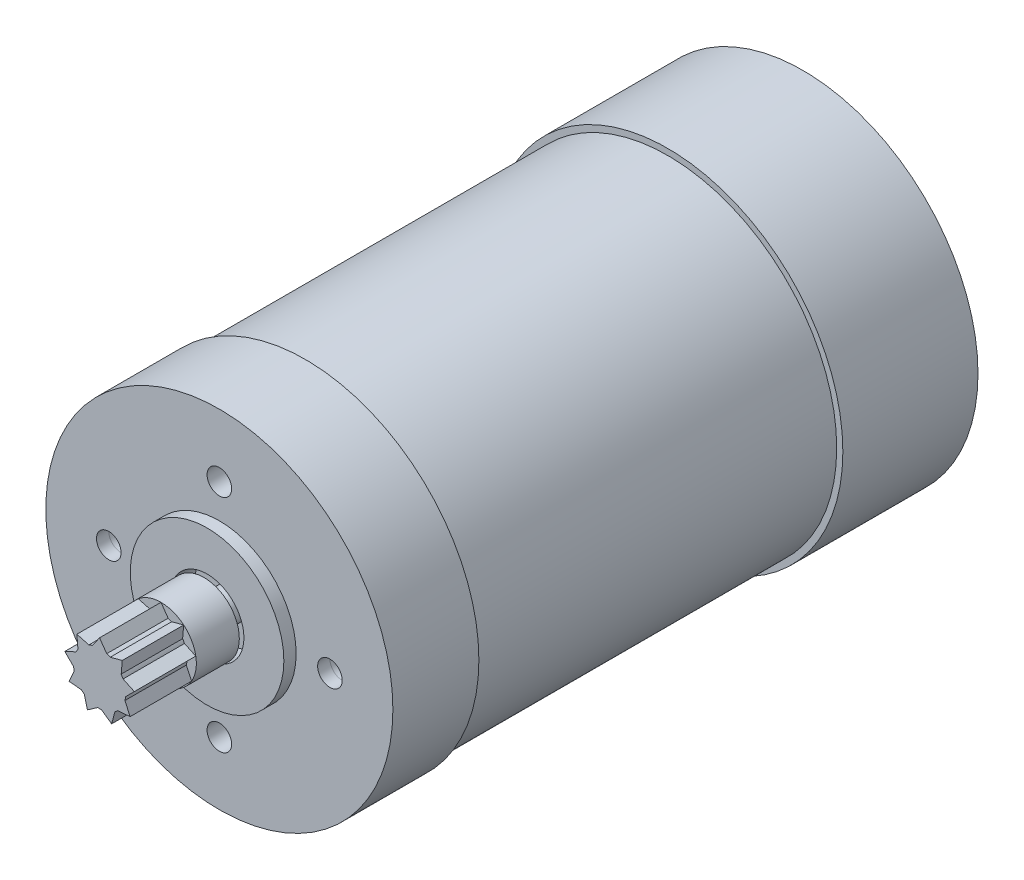
from build123d import *

# Parameters (mm, degrees)
SKETCH5_R           = 2
CUT_EXTRUDE1_DEPTH  = 3
SKETCH13_R          = 6
CUT_EXTRUDE3_DEPTH  = 4
SKETCH14_R          = 2.5
BOSS_EXTRUDE2_DEPTH = 4.5
SKETCH15_R          = 5.75
BOSS_EXTRUDE3_DEPTH = 17
CUT_EXTRUDE7_START  = -10
CUT_EXTRUDE7_DEPTH  = 10
CUT_EXTRUDE9_DEPTH  = 8
BOSS_EXTRUDE7_DEPTH = 6.25
CUT_EXTRUDE10_DEPTH = 5
SPLIT1_START        = -97
SPLIT1_OUTLINE_R    = 28.5
SPLIT1_DEPTH        = 22
SPLIT1_START_2      = -92
SPLIT1_2_DEPTH      = 17
SPLIT1_START_3      = -75
SPLIT1_3_OUTLINE_R  = 27.5
SPLIT1_3_DEPTH      = 59
SPLIT1_START_4      = -105
SPLIT1_4_OUTLINE_R  = 28.5
SPLIT1_4_DEPTH      = 89
SPLIT1_START_5      = -4
SPLIT1_5_OUTLINE_R  = 5.75
SPLIT1_5_DEPTH      = 21.5
SPLIT1_START_6      = 0.5
SPLIT1_6_DEPTH      = 17
SPLIT1_7_DEPTH      = 7
SPLIT1_8_OUTLINE_R  = 2.5
SPLIT1_8_DEPTH      = 4.5
SPLIT1_START_7      = -103.5
SPLIT1_9_DEPTH      = 6.25
SPLIT1_10_DEPTH     = 8


# Read off the part's stored shape, not the designer's step: Split1
with BuildPart() as part:
    # Sketch3 → Revolve1 (revolve)
    with BuildSketch(Plane(origin=(0, 0, 0), x_dir=(0, 0, -1), z_dir=(1, 0, 0)), mode=Mode.PRIVATE) as revolve1_sk:
        Polygon((0, 0), (0, 12.5), (2, 12.5), (2, 28.25), (16, 28.25), (16, 27.5), (75, 27.5), (75, 28.5), (97, 28.5), (97, 3), (105, 3), (105, 0), (97, 0), align=None)
    revolve(revolve1_sk.sketch.rotate(Axis((0, 0, 94.008643936), (0, 0, -1)), 90), axis=Axis((0, 0, 94.008643936), (0, 0, -1)))

    # Sketch5 → Cut-Extrude1 (cut)
    with BuildSketch(Plane.XY.offset(-2)):
        with Locations((0, 18)):
            Circle(SKETCH5_R)
        with Locations((18, 0)):
            Circle(SKETCH5_R)
        with Locations((0, -18)):
            Circle(SKETCH5_R)
        with Locations((-18, 0)):
            Circle(SKETCH5_R)
    extrude(amount=-CUT_EXTRUDE1_DEPTH, mode=Mode.SUBTRACT)

    # Sketch13 → Cut-Extrude3 (cut)
    with BuildSketch(Plane.XY):
        Circle(SKETCH13_R)
    extrude(amount=-CUT_EXTRUDE3_DEPTH, mode=Mode.SUBTRACT)

    # Sketch14 → Boss-Extrude2 (add)
    with BuildSketch(Plane.XY.offset(-4)):
        Circle(SKETCH14_R)
    extrude(amount=BOSS_EXTRUDE2_DEPTH)

    # Sketch15 → Boss-Extrude3 (add)
    with BuildSketch(Plane.XY.offset(0.5)):
        Circle(SKETCH15_R)
    extrude(amount=BOSS_EXTRUDE3_DEPTH)

    # Sketch17 → Cut-Extrude7 (cut)
    with BuildSketch(Plane.XY.offset(17.5).offset(CUT_EXTRUDE7_START)):
        with BuildLine():
            Line((-1.164124293, 4.087458211), (0, 5.75))
            ThreePointArc((0, 5.75), (-1.966615824, 5.40323257), (-3.696028756, 4.404755548))
            Line((-3.696028756, 4.404755548), (-1.735596548, 3.879459321))
            ThreePointArc((-1.735596548, 3.879459321), (-1.453585609, 3.993693638), (-1.164124293, 4.087458211))
        make_face()
        with BuildLine():
            Line((-3.519138439, 2.382889978), (-3.696028756, 4.404755548))
            ThreePointArc((-3.696028756, 4.404755548), (-4.979646072, 2.875), (-5.66264458, 0.998477022))
            Line((-5.66264458, 0.998477022), (-3.823212475, 1.856218299))
            ThreePointArc((-3.823212475, 1.856218299), (-3.680607966, 2.125), (-3.519138439, 2.382889978))
        make_face()
        with BuildLine():
            Line((-4.227508599, -0.436658959), (-5.66264458, 0.998477022))
            ThreePointArc((-5.66264458, 0.998477022), (-5.66264458, -0.998477022), (-4.979646072, -2.875))
            Line((-4.979646072, -2.875), (-4.121904795, -1.035567895))
            ThreePointArc((-4.121904795, -1.035567895), (-4.18543295, -0.738004755), (-4.227508599, -0.436658959))
        make_face()
        with BuildLine():
            Line((-2.957780502, -3.051890317), (-4.979646072, -2.875))
            ThreePointArc((-4.979646072, -2.875), (-3.696028756, -4.404755548), (-1.966615824, -5.40323257))
            Line((-1.966615824, -5.40323257), (-2.491912051, -3.442800362))
            ThreePointArc((-2.491912051, -3.442800362), (-2.731847341, -3.255688883), (-2.957780502, -3.051890317))
        make_face()
        with BuildLine():
            Line((-0.304074036, -4.239108277), (-1.966615824, -5.40323257))
            ThreePointArc((-1.966615824, -5.40323257), (0, -5.75), (1.966615824, -5.40323257))
            Line((1.966615824, -5.40323257), (0.304074036, -4.239108277))
            ThreePointArc((0.304074036, -4.239108277), (0, -4.25), (-0.304074036, -4.239108277))
        make_face()
        with BuildLine():
            ThreePointArc((1.966615824, -5.40323257), (3.696028756, -4.404755548), (4.979646072, -2.875))
            Line((4.979646072, -2.875), (2.957780502, -3.051890317))
            ThreePointArc((2.957780502, -3.051890317), (2.731847341, -3.255688883), (2.491912051, -3.442800362))
            Line((2.491912051, -3.442800362), (1.966615824, -5.40323257))
        make_face()
        with BuildLine():
            ThreePointArc((5.75, 0), (5.728119514, 0.501145521), (5.66264458, 0.998477022))
            Line((5.66264458, 0.998477022), (4.227508599, -0.436658959))
            ThreePointArc((4.227508599, -0.436658959), (4.18543295, -0.738004755), (4.121904795, -1.035567895))
            Line((4.121904795, -1.035567895), (4.979646072, -2.875))
            ThreePointArc((4.979646072, -2.875), (5.554073501, -1.488209509), (5.75, 0))
        make_face()
        with BuildLine():
            ThreePointArc((5.66264458, 0.998477022), (4.979646072, 2.875), (3.696028756, 4.404755548))
            Line((3.696028756, 4.404755548), (3.519138439, 2.382889978))
            ThreePointArc((3.519138439, 2.382889978), (3.680607966, 2.125), (3.823212475, 1.856218299))
            Line((3.823212475, 1.856218299), (5.66264458, 0.998477022))
        make_face()
        with BuildLine():
            ThreePointArc((3.696028756, 4.404755548), (1.966615824, 5.40323257), (0, 5.75))
            Line((0, 5.75), (1.164124293, 4.087458211))
            ThreePointArc((1.164124293, 4.087458211), (1.453585609, 3.993693638), (1.735596548, 3.879459321))
            Line((1.735596548, 3.879459321), (3.696028756, 4.404755548))
        make_face()
    extrude(amount=CUT_EXTRUDE7_DEPTH, mode=Mode.SUBTRACT)

    # Sketch24 → Cut-Extrude9 (cut)
    with BuildSketch(Plane(origin=(0, 0, -105), x_dir=(-1, 0, 0), z_dir=(0, 0, -1))):
        with BuildLine():
            Line((-2.8, -1.077032961), (2.8, -1.077032961))
            ThreePointArc((2.8, -1.077032961), (0, -3), (-2.8, -1.077032961))
        make_face()
    extrude(amount=-CUT_EXTRUDE9_DEPTH, mode=Mode.SUBTRACT)

    # Sketch26 → Boss-Extrude7 (add)
    with BuildSketch(Plane(origin=(0, 0, -103.5), x_dir=(-1, 0, 0), z_dir=(0, 0, -1))):
        Polygon((0, 11.547005384), (-10, 5.773502692), (-10, -5.773502692), (0, -11.547005384), (10, -5.773502692), (10, 5.773502692), align=None)
    extrude(amount=-BOSS_EXTRUDE7_DEPTH)

    # Sketch27 → Cut-Extrude10 (cut)
    with BuildSketch(Plane(origin=(0, 0, -97), x_dir=(-1, 0, 0), z_dir=(0, 0, -1))):
        with BuildLine():
            ThreePointArc((23.995222971, -0.478826225), (22.908918278, 7.154122122), (19.458462601, 14.048780488))
            ThreePointArc((19.458462601, 14.048780488), (14.571989651, 14.837692463), (13.783077676, 9.951219512))
            ThreePointArc((13.783077676, 9.951219512), (16.227150447, 5.06750317), (16.996616271, -0.339168576))
            ThreePointArc((16.996616271, -0.339168576), (20.426090797, -3.908300751), (23.995222971, -0.478826225))
        make_face()
        with BuildLine():
            ThreePointArc((-23.995222971, -0.478826225), (-22.908918278, 7.154122122), (-19.458462601, 14.048780488))
            ThreePointArc((-19.458462601, 14.048780488), (-14.571989651, 14.837692463), (-13.783077676, 9.951219512))
            ThreePointArc((-13.783077676, 9.951219512), (-16.227150447, 5.06750317), (-16.996616271, -0.339168576))
            ThreePointArc((-16.996616271, -0.339168576), (-20.426090797, -3.908300751), (-23.995222971, -0.478826225))
        make_face()
    extrude(amount=-CUT_EXTRUDE10_DEPTH, mode=Mode.SUBTRACT)

    # Split1 4 outline → Split1 4 (cut)
    with BuildSketch(Plane.XY.offset(SPLIT1_START_4)):
        Circle(SPLIT1_4_OUTLINE_R)
    extrude(amount=SPLIT1_4_DEPTH, mode=Mode.SUBTRACT)

    # Split1 5 outline → Split1 5 (cut)
    with BuildSketch(Plane.XY.offset(SPLIT1_START_5)):
        Circle(SPLIT1_5_OUTLINE_R)
    extrude(amount=SPLIT1_5_DEPTH, mode=Mode.SUBTRACT)


with BuildPart() as body_2:
    # Split1 outline → Split1 (new body)
    with BuildSketch(Plane.XY.offset(SPLIT1_START)):
        Circle(SPLIT1_OUTLINE_R)
        with BuildLine():
            ThreePointArc((-13.783077676, 9.951219512), (-16.227150447, 5.06750317), (-16.996616271, -0.339168576))
            ThreePointArc((-16.996616271, -0.339168576), (-20.426090796, -3.908300751), (-23.995222971, -0.478826225))
            ThreePointArc((-23.995222971, -0.478826225), (-22.908918278, 7.154122122), (-19.458462601, 14.048780488))
            ThreePointArc((-19.458462601, 14.048780488), (-14.57198965, 14.837692463), (-13.783077676, 9.951219512))
        make_face(mode=Mode.SUBTRACT)
        with BuildLine():
            ThreePointArc((19.458462601, 14.048780488), (22.908918278, 7.154122122), (23.995222971, -0.478826225))
            ThreePointArc((23.995222971, -0.478826225), (20.426090796, -3.908300751), (16.996616271, -0.339168576))
            ThreePointArc((16.996616271, -0.339168576), (16.227150447, 5.06750317), (13.783077676, 9.951219512))
            ThreePointArc((13.783077676, 9.951219512), (14.57198965, 14.837692463), (19.458462601, 14.048780488))
        make_face(mode=Mode.SUBTRACT)
    extrude(amount=SPLIT1_DEPTH)

    # Split1 2 outline → Split1 2 (add)
    with BuildSketch(Plane.XY.offset(SPLIT1_START_2)):
        with BuildLine():
            ThreePointArc((16.996616271, -0.339168576), (20.426090796, -3.908300751), (23.995222971, -0.478826225))
            ThreePointArc((23.995222971, -0.478826225), (22.908918278, 7.154122122), (19.458462601, 14.048780488))
            ThreePointArc((19.458462601, 14.048780488), (14.57198965, 14.837692463), (13.783077676, 9.951219512))
            ThreePointArc((13.783077676, 9.951219512), (16.227150447, 5.06750317), (16.996616271, -0.339168576))
        make_face()
        with BuildLine():
            ThreePointArc((-23.995222971, -0.478826225), (-20.426090796, -3.908300751), (-16.996616271, -0.339168576))
            ThreePointArc((-16.996616271, -0.339168576), (-16.227150447, 5.06750317), (-13.783077676, 9.951219512))
            ThreePointArc((-13.783077676, 9.951219512), (-14.57198965, 14.837692463), (-19.458462601, 14.048780488))
            ThreePointArc((-19.458462601, 14.048780488), (-22.908918278, 7.154122122), (-23.995222971, -0.478826225))
        make_face()
    extrude(amount=SPLIT1_2_DEPTH)


with BuildPart() as body_3:
    # Split1 3 outline → Split1 3 (new body)
    with BuildSketch(Plane.XY.offset(SPLIT1_START_3)):
        Circle(SPLIT1_3_OUTLINE_R)
    extrude(amount=SPLIT1_3_DEPTH)


with BuildPart() as body_4:
    # Split1 6 outline → Split1 6 (new body)
    with BuildSketch(Plane.XY.offset(SPLIT1_START_6)):
        with BuildLine():
            Line((4.227508599, -0.436658959), (5.66264458, 0.998477022))
            Line((5.66264458, 0.998477022), (3.823212475, 1.856218299))
            ThreePointArc((3.823212475, 1.856218299), (3.680607966, 2.125), (3.519138439, 2.382889978))
            Line((3.519138439, 2.382889978), (3.696028756, 4.404755548))
            Line((3.696028756, 4.404755548), (1.735596548, 3.879459321))
            ThreePointArc((1.735596548, 3.879459321), (1.453585609, 3.993693638), (1.164124293, 4.087458211))
            Line((1.164124293, 4.087458211), (0, 5.75))
            Line((0, 5.75), (-1.164124293, 4.087458211))
            ThreePointArc((-1.164124293, 4.087458211), (-1.453585609, 3.993693638), (-1.735596548, 3.879459321))
            Line((-1.735596548, 3.879459321), (-3.696028756, 4.404755548))
            Line((-3.696028756, 4.404755548), (-3.519138439, 2.382889978))
            ThreePointArc((-3.519138439, 2.382889978), (-3.680607966, 2.125), (-3.823212475, 1.856218299))
            Line((-3.823212475, 1.856218299), (-5.66264458, 0.998477022))
            Line((-5.66264458, 0.998477022), (-4.227508599, -0.436658959))
            ThreePointArc((-4.227508599, -0.436658959), (-4.18543295, -0.738004755), (-4.121904795, -1.035567895))
            Line((-4.121904795, -1.035567895), (-4.979646072, -2.875))
            Line((-4.979646072, -2.875), (-2.957780502, -3.051890317))
            ThreePointArc((-2.957780502, -3.051890317), (-2.731847341, -3.255688883), (-2.491912051, -3.442800362))
            Line((-2.491912051, -3.442800362), (-1.966615824, -5.40323257))
            Line((-1.966615824, -5.40323257), (-0.304074036, -4.239108277))
            ThreePointArc((-0.304074036, -4.239108277), (0, -4.25), (0.304074036, -4.239108277))
            Line((0.304074036, -4.239108277), (1.966615824, -5.40323257))
            Line((1.966615824, -5.40323257), (2.491912051, -3.442800362))
            ThreePointArc((2.491912051, -3.442800362), (2.731847341, -3.255688883), (2.957780502, -3.051890317))
            Line((2.957780502, -3.051890317), (4.979646072, -2.875))
            Line((4.979646072, -2.875), (4.121904795, -1.035567895))
            ThreePointArc((4.121904795, -1.035567895), (4.18543295, -0.738004755), (4.227508599, -0.436658959))
        make_face()
    extrude(amount=SPLIT1_6_DEPTH)

    # Split1 7 outline → Split1 7 (add)
    with BuildSketch(Plane.XY.offset(SPLIT1_START_6)):
        with BuildLine():
            ThreePointArc((4.979646072, -2.875), (5.66264458, -0.998477021), (5.66264458, 0.998477022))
            Line((5.66264458, 0.998477022), (4.227508599, -0.436658959))
            ThreePointArc((4.227508599, -0.436658959), (4.18543295, -0.738004755), (4.121904795, -1.035567895))
            Line((4.121904795, -1.035567895), (4.979646072, -2.875))
        make_face()
        with BuildLine():
            Line((3.823212475, 1.856218299), (5.66264458, 0.998477022))
            ThreePointArc((5.66264458, 0.998477022), (4.979646072, 2.875), (3.696028756, 4.404755548))
            Line((3.696028756, 4.404755548), (3.519138439, 2.382889978))
            ThreePointArc((3.519138439, 2.382889978), (3.680607966, 2.125), (3.823212475, 1.856218299))
        make_face()
        with BuildLine():
            ThreePointArc((1.966615824, -5.40323257), (3.696028756, -4.404755548), (4.979646072, -2.875))
            Line((4.979646072, -2.875), (2.957780502, -3.051890317))
            ThreePointArc((2.957780502, -3.051890317), (2.731847341, -3.255688883), (2.491912051, -3.442800362))
            Line((2.491912051, -3.442800362), (1.966615824, -5.40323257))
        make_face()
        with BuildLine():
            Line((1.735596548, 3.879459321), (3.696028756, 4.404755548))
            ThreePointArc((3.696028756, 4.404755548), (1.966615824, 5.403232569), (0, 5.75))
            Line((0, 5.75), (1.164124293, 4.087458211))
            ThreePointArc((1.164124293, 4.087458211), (1.453585609, 3.993693638), (1.735596548, 3.879459321))
        make_face()
        with BuildLine():
            ThreePointArc((-1.966615824, -5.40323257), (0, -5.75), (1.966615824, -5.40323257))
            Line((1.966615824, -5.40323257), (0.304074036, -4.239108277))
            ThreePointArc((0.304074036, -4.239108277), (0, -4.25), (-0.304074036, -4.239108277))
            Line((-0.304074036, -4.239108277), (-1.966615824, -5.40323257))
        make_face()
        with BuildLine():
            Line((-1.164124293, 4.087458211), (0, 5.75))
            ThreePointArc((0, 5.75), (-1.966615824, 5.403232569), (-3.696028756, 4.404755548))
            Line((-3.696028756, 4.404755548), (-1.735596548, 3.879459321))
            ThreePointArc((-1.735596548, 3.879459321), (-1.453585609, 3.993693638), (-1.164124293, 4.087458211))
        make_face()
        with BuildLine():
            ThreePointArc((-4.979646072, -2.875), (-3.696028756, -4.404755548), (-1.966615824, -5.40323257))
            Line((-1.966615824, -5.40323257), (-2.491912051, -3.442800362))
            ThreePointArc((-2.491912051, -3.442800362), (-2.731847341, -3.255688883), (-2.957780502, -3.051890317))
            Line((-2.957780502, -3.051890317), (-4.979646072, -2.875))
        make_face()
        with BuildLine():
            Line((-3.519138439, 2.382889978), (-3.696028756, 4.404755548))
            ThreePointArc((-3.696028756, 4.404755548), (-4.979646072, 2.875), (-5.66264458, 0.998477022))
            Line((-5.66264458, 0.998477022), (-3.823212475, 1.856218299))
            ThreePointArc((-3.823212475, 1.856218299), (-3.680607966, 2.125), (-3.519138439, 2.382889978))
        make_face()
        with BuildLine():
            ThreePointArc((-5.66264458, 0.998477022), (-5.66264458, -0.998477021), (-4.979646072, -2.875))
            Line((-4.979646072, -2.875), (-4.121904795, -1.035567895))
            ThreePointArc((-4.121904795, -1.035567895), (-4.18543295, -0.738004755), (-4.227508599, -0.436658959))
            Line((-4.227508599, -0.436658959), (-5.66264458, 0.998477022))
        make_face()
    extrude(amount=SPLIT1_7_DEPTH)

    # Split1 8 outline → Split1 8 (add)
    with BuildSketch(Plane.XY.offset(SPLIT1_START_5)):
        Circle(SPLIT1_8_OUTLINE_R)
    extrude(amount=SPLIT1_8_DEPTH)


with BuildPart() as body_5:
    # Split1 9 outline → Split1 9 (new body)
    with BuildSketch(Plane.XY.offset(SPLIT1_START_7)):
        Polygon((10, -5.773502692), (10, 5.773502692), (0, 11.547005384), (-10, 5.773502692), (-10, -5.773502692), (0, -11.547005384), align=None)
    extrude(amount=SPLIT1_9_DEPTH)

    # Split1 10 outline → Split1 10 (add)
    with BuildSketch(Plane.XY.offset(SPLIT1_START_4)):
        with BuildLine():
            Line((-2.8, -1.077032961), (2.8, -1.077032961))
            ThreePointArc((2.8, -1.077032961), (0, 3), (-2.8, -1.077032961))
        make_face()
    extrude(amount=SPLIT1_10_DEPTH)


solid = Compound([part.part, body_2.part, body_3.part, body_4.part, body_5.part])
